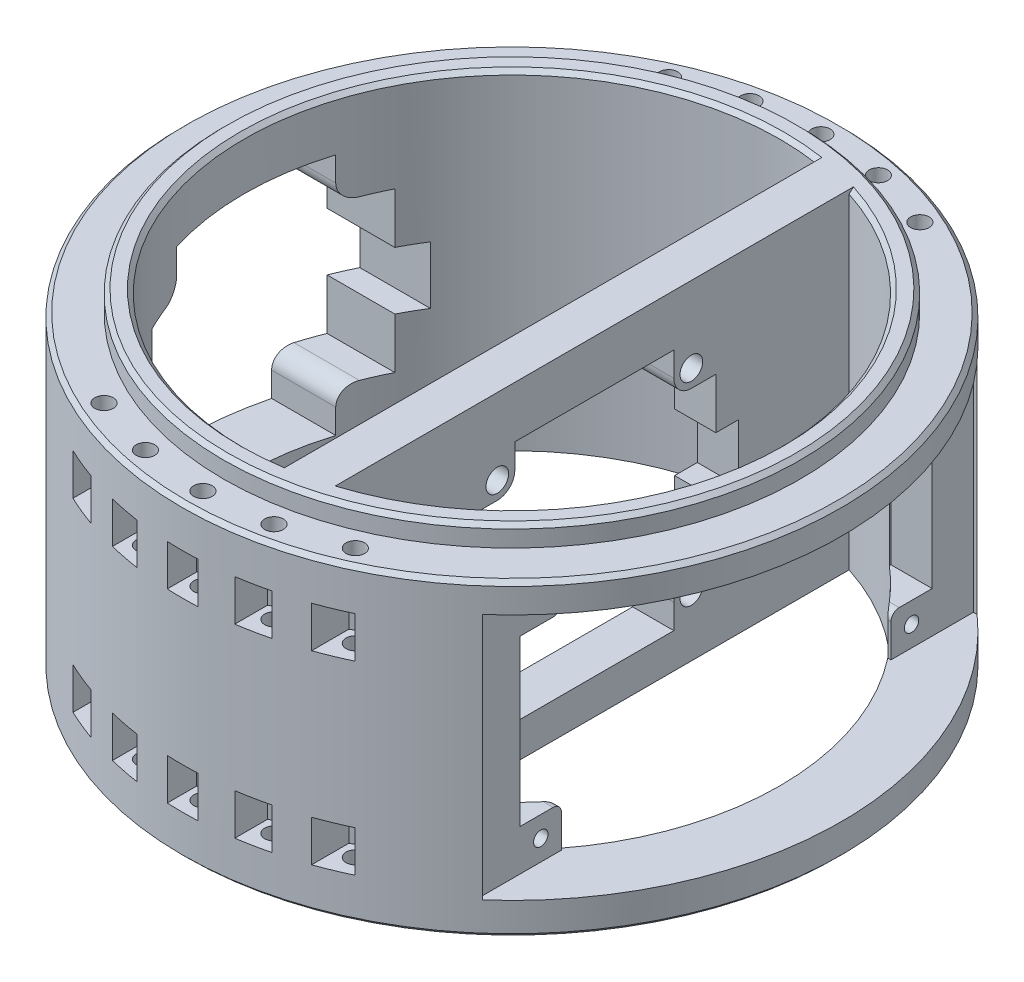
from build123d import *

# Parameters (mm, degrees)
BOSS_EXTRUDE1_OUTLINE_R = 80
BOSS_EXTRUDE1_DEPTH     = 80
CUT_EXTRUDE4_DEPTH      = 139.564064606
CUT_EXTRUDE4_DEPTH_BACK = 139.564064606
SKETCH4_R               = 4
CUT_EXTRUDE1_START      = -80.000000101
CUT_EXTRUDE1_OUTLINE_R  = 4
CUT_EXTRUDE1_DEPTH      = 100.000000101
CUT_EXTRUDE10_START     = 29
SKETCH2_4_R             = 2.75
CUT_EXTRUDE10_DEPTH     = 20
CUT_EXTRUDE11_START     = 52
SKETCH7_W               = 120
SKETCH7_H               = 60
CUT_EXTRUDE11_DEPTH     = 87.564064779
SKETCH8_R               = 1.75
CUT_EXTRUDE12_DEPTH     = 20
CUT_EXTRUDE_5_DEPTH     = 10
SKETCH_1_R              = 111.428602378
SKETCH_1_R_2            = 70
CUT_EXTRUDE_1_DEPTH     = 5
SKETCH_2_R              = 2.25
CUT_EXTRUDE_2_DEPTH     = 139.564064779
CUT_EXTRUDE_START       = 55
SKETCH_2_3_R            = 2.25
CUT_EXTRUDE_3_DEPTH     = 10
CUT_EXTRUDE_START_2     = 10
CUT_EXTRUDE_6_DEPTH     = 10
CHAMFER_1_SIZE          = 1
CHAMFER_2_SIZE          = 1
CUT_EXTRUDE_START_3     = -3
CUT_EXTRUDE_4_DEPTH     = 10
FILLET_1_R              = 2


# Read off the part's stored shape, not the designer's step: Boss-Extrude1, Cut-Extrude1
with BuildPart() as part:
    # Boss-Extrude1 outline → Boss-Extrude1 (new body)
    with BuildSketch(Plane(origin=(0, 0, 0), x_dir=(1, 0, 0), z_dir=(0, 1, 0))):
        Circle(BOSS_EXTRUDE1_OUTLINE_R)
        with BuildLine():
            ThreePointArc((10, -64.226162893), (-65, 0), (10, 64.226162893))
            Line((10, 64.226162893), (10, -64.226162893))
        make_face(mode=Mode.SUBTRACT)
        with BuildLine():
            Line((20, -61.846584384), (20, 61.846584384))
            ThreePointArc((20, 61.846584384), (65, 0), (20, -61.846584384))
        make_face(mode=Mode.SUBTRACT)
    extrude(amount=BOSS_EXTRUDE1_DEPTH)

    # Sketch4 → Cut-Extrude4 (cut, two sides: drawn at the far end of the back side and taken through both)
    with BuildSketch(Plane(origin=(0, 0, 0), x_dir=(0, 0, -1), z_dir=(1, 0, 0)).offset(-CUT_EXTRUDE4_DEPTH_BACK)):
        with Locations((0, 38)):
            Circle(SKETCH4_R)
    extrude(amount=CUT_EXTRUDE4_DEPTH + CUT_EXTRUDE4_DEPTH_BACK, mode=Mode.SUBTRACT)

    # Cut-Extrude1 outline → Cut-Extrude1 (cut)
    with BuildSketch(Plane(origin=(0, 0, 0), x_dir=(0, 0, -1), z_dir=(1, 0, 0)).offset(CUT_EXTRUDE1_START)):
        with BuildLine():
            ThreePointArc((19.3, 14.45), (20.54479618, 17.45520382), (23.55, 18.7))
            Line((23.55, 18.7), (29.5, 18.7))
            Line((29.5, 18.7), (29.5, 31))
            Line((29.5, 31), (35, 31))
            Line((35, 31), (35, 45))
            Line((35, 45), (29.5, 45))
            Line((29.5, 45), (29.5, 57.3))
            Line((29.5, 57.3), (23.55, 57.3))
            ThreePointArc((23.55, 57.3), (20.54479618, 58.54479618), (19.3, 61.55))
            Line((19.3, 61.55), (19.3, 67.5))
            Line((19.3, 67.5), (-19.3, 67.5))
            Line((-19.3, 67.5), (-19.3, 61.55))
            ThreePointArc((-19.3, 61.55), (-20.54479618, 58.54479618), (-23.55, 57.3))
            Line((-23.55, 57.3), (-29.5, 57.3))
            Line((-29.5, 57.3), (-29.5, 45))
            Line((-29.5, 45), (-35, 45))
            Line((-35, 45), (-35, 31))
            Line((-35, 31), (-29.5, 31))
            Line((-29.5, 31), (-29.5, 18.7))
            Line((-29.5, 18.7), (-23.55, 18.7))
            ThreePointArc((-23.55, 18.7), (-20.54479618, 17.45520382), (-19.3, 14.45))
            Line((-19.3, 14.45), (-19.3, 8.5))
            Line((-19.3, 8.5), (19.3, 8.5))
            Line((19.3, 8.5), (19.3, 14.45))
        make_face()
        with Locations((0, 38)):
            Circle(CUT_EXTRUDE1_OUTLINE_R, mode=Mode.SUBTRACT)
    extrude(amount=CUT_EXTRUDE1_DEPTH, mode=Mode.SUBTRACT)

    # Sketch2<4> → Cut-Extrude10 (cut)
    with BuildSketch(Plane(origin=(0, 0, 0), x_dir=(0, 0, -1), z_dir=(1, 0, 0)).offset(CUT_EXTRUDE10_START)):
        with Locations(Location((-23.55, 61.55, 0), (0, 0, 180))):
            Circle(SKETCH2_4_R)
        with Locations(Location((23.55, 61.55, 0), (0, 0, 180))):
            Circle(SKETCH2_4_R)
        with Locations(Location((-23.55, 14.45, 0), (0, 0, 180))):
            Circle(SKETCH2_4_R)
        with Locations(Location((23.55, 14.45, 0), (0, 0, 180))):
            Circle(SKETCH2_4_R)
    extrude(amount=-CUT_EXTRUDE10_DEPTH, mode=Mode.SUBTRACT)

    # Sketch7 → Cut-Extrude11 (cut, through all)
    with BuildSketch(Plane(origin=(0, 0, 0), x_dir=(0, 0, -1), z_dir=(1, 0, 0)).offset(CUT_EXTRUDE11_START)):
        with Locations((0, 38)):
            Rectangle(SKETCH7_W, SKETCH7_H)
    extrude(amount=CUT_EXTRUDE11_DEPTH, mode=Mode.SUBTRACT)

    # Sketch8 → Cut-Extrude12 (cut)
    with BuildSketch(Plane(origin=(52, 0, 0), x_dir=(0, 0, -1), z_dir=(1, 0, 0))):
        with Locations((-45, 63)):
            Circle(SKETCH8_R)
        with Locations((-45, 13)):
            Circle(SKETCH8_R)
        with Locations((45, 13)):
            Circle(SKETCH8_R)
        with Locations((45, 63)):
            Circle(SKETCH8_R)
    extrude(amount=-CUT_EXTRUDE12_DEPTH, mode=Mode.SUBTRACT)

    # Sketch8<4> → Вырез-Вытянуть5 (cut)
    with BuildSketch(Plane(origin=(52, 0, 0), x_dir=(0, 0, -1), z_dir=(1, 0, 0))):
        Polygon((-40, 58), (-45, 58), (-50, 58), (-50, 18), (-45, 18), (-40, 18), (-40, 8), (39, 8), (39, 68), (-40, 68), align=None)
        Polygon((40, 68), (39, 68), (39, 8), (40, 8), (40, 18), (45, 18), (50, 18), (50, 58), (45, 58), (40, 58), align=None)
    extrude(amount=-CUT_EXTRUDE_5_DEPTH, mode=Mode.SUBTRACT)

    # Эскиз1 → Вырез-Вытянуть1 (cut)
    with BuildSketch(Plane(origin=(0, 80, 0), x_dir=(1, 0, 0), z_dir=(0, 1, 0))):
        Circle(SKETCH_1_R)
        with Locations(Location((0, 0, 0), (0, 0, 270))):
            Circle(SKETCH_1_R_2, mode=Mode.SUBTRACT)
    extrude(amount=-CUT_EXTRUDE_1_DEPTH, mode=Mode.SUBTRACT)

    # Эскиз2 → Вырез-Вытянуть2 (cut, through all)
    with BuildSketch(Plane(origin=(0, 0, 0), x_dir=(1, 0, 0), z_dir=(0, 1, 0))):
        with Locations(Location((0, 75, 0), (0, 0, 270))):
            Circle(SKETCH_2_R)
        with Locations(Location((15.593376811, 73.361070055, 0), (0, 0, 270))):
            Circle(SKETCH_2_R)
        with Locations(Location((30.505248231, 68.515909323, 0), (0, 0, 270))):
            Circle(SKETCH_2_R)
        with Locations(Location((-30.505248231, 68.515909323, 0), (0, 0, 90))):
            Circle(SKETCH_2_R)
        with Locations(Location((-15.593376811, 73.361070055, 0), (0, 0, 90))):
            Circle(SKETCH_2_R)
    cut_extrude_2 = extrude(amount=CUT_EXTRUDE_2_DEPTH, mode=Mode.SUBTRACT)

    # Эскиз2<3> → Вырез-Вытянуть3 (cut)
    # profile 1 of 5: a face of its own
    with BuildSketch(Plane(origin=(0, 0, 0), x_dir=(1, 0, 0), z_dir=(0, 1, 0)).offset(CUT_EXTRUDE_START)):
        with BuildLine():
            ThreePointArc((3.75, 79.912061042), (0, 80), (-3.75, 79.912061042))
            Line((-3.75, 79.912061042), (-3.75, 72.834936491))
            Line((-3.75, 72.834936491), (0, 70.669872981))
            Line((0, 70.669872981), (3.75, 72.834936491))
            Line((3.75, 72.834936491), (3.75, 79.912061042))
        make_face()
        with Locations(Location((0, 75, 0), (0, 0, 270))):
            Circle(SKETCH_2_3_R, mode=Mode.SUBTRACT)
    # profile 2 of 5: a face of its own
    with BuildSketch(Plane(origin=(0, 0, 0), x_dir=(1, 0, 0), z_dir=(0, 1, 0)).offset(CUT_EXTRUDE_START)):
        with BuildLine():
            ThreePointArc((-11.843376811, 79.118483464), (-15.61121696, 78.462028428), (-19.343376811, 77.626244103))
            Line((-19.343376811, 77.626244103), (-19.343376811, 71.196006546))
            Line((-19.343376811, 71.196006546), (-15.593376811, 69.030943036))
            Line((-15.593376811, 69.030943036), (-11.843376811, 71.196006546))
            Line((-11.843376811, 71.196006546), (-11.843376811, 79.118483464))
        make_face()
        with Locations(Location((-15.593376811, 73.361070055, 0), (0, 0, 90))):
            Circle(SKETCH_2_3_R, mode=Mode.SUBTRACT)
    # profile 3 of 5: a face of its own
    with BuildSketch(Plane(origin=(0, 0, 0), x_dir=(1, 0, 0), z_dir=(0, 1, 0)).offset(CUT_EXTRUDE_START)):
        with BuildLine():
            ThreePointArc((19.343376811, 77.626244103), (15.61121696, 78.462028428), (11.843376811, 79.118483464))
            Line((11.843376811, 79.118483464), (11.843376811, 71.196006546))
            Line((11.843376811, 71.196006546), (15.593376811, 69.030943036))
            Line((15.593376811, 69.030943036), (19.343376811, 71.196006546))
            Line((19.343376811, 71.196006546), (19.343376811, 77.626244103))
        make_face()
        with Locations(Location((15.593376811, 73.361070055, 0), (0, 0, 270))):
            Circle(SKETCH_2_3_R, mode=Mode.SUBTRACT)
    # profile 4 of 5: a face of its own
    with BuildSketch(Plane(origin=(0, 0, 0), x_dir=(1, 0, 0), z_dir=(0, 1, 0)).offset(CUT_EXTRUDE_START)):
        with BuildLine():
            ThreePointArc((-26.755248231, 75.393346471), (-30.544557454, 73.939367119), (-34.255248231, 72.295075687))
            Line((-34.255248231, 72.295075687), (-34.255248231, 66.350845814))
            Line((-34.255248231, 66.350845814), (-30.505248231, 64.185782304))
            Line((-30.505248231, 64.185782304), (-26.755248231, 66.350845814))
            Line((-26.755248231, 66.350845814), (-26.755248231, 75.393346471))
        make_face()
        with Locations(Location((-30.505248231, 68.515909323, 0), (0, 0, 90))):
            Circle(SKETCH_2_3_R, mode=Mode.SUBTRACT)
    # profile 5 of 5: a face of its own
    with BuildSketch(Plane(origin=(0, 0, 0), x_dir=(1, 0, 0), z_dir=(0, 1, 0)).offset(CUT_EXTRUDE_START)):
        with BuildLine():
            ThreePointArc((34.255248231, 72.295075687), (30.544557454, 73.939367119), (26.755248231, 75.393346471))
            Line((26.755248231, 75.393346471), (26.755248231, 66.350845814))
            Line((26.755248231, 66.350845814), (30.505248231, 64.185782304))
            Line((30.505248231, 64.185782304), (34.255248231, 66.350845814))
            Line((34.255248231, 66.350845814), (34.255248231, 72.295075687))
        make_face()
        with Locations(Location((30.505248231, 68.515909323, 0), (0, 0, 270))):
            Circle(SKETCH_2_3_R, mode=Mode.SUBTRACT)
    cut_extrude_3 = extrude(amount=CUT_EXTRUDE_3_DEPTH, mode=Mode.SUBTRACT)

    # Эскиз2<4> → Вырез-Вытянуть6 (cut)
    with BuildSketch(Plane(origin=(0, 0, 0), x_dir=(1, 0, 0), z_dir=(0, 1, 0)).offset(CUT_EXTRUDE_START_2)):
        with BuildLine():
            Line((0, 79.330127019), (-3.75, 77.165063509))
            Line((-3.75, 77.165063509), (-0.612372436, 77.165063509))
            ThreePointArc((-0.612372436, 77.165063509), (0, 77.25), (0.612372436, 77.165063509))
            Line((0.612372436, 77.165063509), (3.75, 77.165063509))
            Line((3.75, 77.165063509), (0, 79.330127019))
        make_face()
        Polygon((-3.75, 92.498176102), (-3.75, 77.165063509), (0, 79.330127019), (3.75, 77.165063509), (3.75, 92.498176102), align=None)
        with BuildLine():
            Line((-0.612372436, 77.165063509), (-3.75, 77.165063509))
            Line((-3.75, 77.165063509), (-3.75, 72.834936491))
            Line((-3.75, 72.834936491), (0, 70.669872981))
            Line((0, 70.669872981), (3.75, 72.834936491))
            Line((3.75, 72.834936491), (3.75, 77.165063509))
            Line((3.75, 77.165063509), (0.612372436, 77.165063509))
            ThreePointArc((0.612372436, 77.165063509), (1.794482931, 76.357324946), (2.25, 75))
            ThreePointArc((2.25, 75), (-1.357324946, 73.205517069), (-0.612372436, 77.165063509))
        make_face()
        with BuildLine():
            ThreePointArc((0.612372436, 77.165063509), (0, 77.25), (-0.612372436, 77.165063509))
            Line((-0.612372436, 77.165063509), (0.612372436, 77.165063509))
        make_face()
        with BuildLine():
            Line((0.612372436, 77.165063509), (-0.612372436, 77.165063509))
            ThreePointArc((-0.612372436, 77.165063509), (-1.357324946, 73.205517069), (2.25, 75))
            ThreePointArc((2.25, 75), (1.794482931, 76.357324946), (0.612372436, 77.165063509))
        make_face()
        Polygon((11.843376811, 90.859246157), (11.843376811, 75.526133564), (15.593376811, 77.691197074), (19.343376811, 75.526133564), (19.343376811, 90.859246157), align=None)
        with BuildLine():
            Line((14.981004376, 75.526133564), (11.843376811, 75.526133564))
            Line((11.843376811, 75.526133564), (11.843376811, 71.196006546))
            Line((11.843376811, 71.196006546), (15.593376811, 69.030943036))
            Line((15.593376811, 69.030943036), (19.343376811, 71.196006546))
            Line((19.343376811, 71.196006546), (19.343376811, 75.526133564))
            Line((19.343376811, 75.526133564), (16.205749247, 75.526133564))
            ThreePointArc((16.205749247, 75.526133564), (17.387859742, 74.718395001), (17.843376811, 73.361070055))
            ThreePointArc((17.843376811, 73.361070055), (14.236051865, 71.566587124), (14.981004376, 75.526133564))
        make_face()
        with BuildLine():
            Line((15.593376811, 77.691197074), (11.843376811, 75.526133564))
            Line((11.843376811, 75.526133564), (14.981004376, 75.526133564))
            ThreePointArc((14.981004376, 75.526133564), (15.593376811, 75.611070055), (16.205749247, 75.526133564))
            Line((16.205749247, 75.526133564), (19.343376811, 75.526133564))
            Line((19.343376811, 75.526133564), (15.593376811, 77.691197074))
        make_face()
        with BuildLine():
            ThreePointArc((16.205749247, 75.526133564), (15.593376811, 75.611070055), (14.981004376, 75.526133564))
            Line((14.981004376, 75.526133564), (16.205749247, 75.526133564))
        make_face()
        with BuildLine():
            Line((16.205749247, 75.526133564), (14.981004376, 75.526133564))
            ThreePointArc((14.981004376, 75.526133564), (14.236051865, 71.566587124), (17.843376811, 73.361070055))
            ThreePointArc((17.843376811, 73.361070055), (17.387859742, 74.718395001), (16.205749247, 75.526133564))
        make_face()
        Polygon((26.755248231, 86.014085426), (26.755248231, 70.680972833), (30.505248231, 72.846036342), (34.255248231, 70.680972833), (34.255248231, 86.014085426), align=None)
        with BuildLine():
            Line((29.892875795, 70.680972833), (26.755248231, 70.680972833))
            Line((26.755248231, 70.680972833), (26.755248231, 66.350845814))
            Line((26.755248231, 66.350845814), (30.505248231, 64.185782304))
            Line((30.505248231, 64.185782304), (34.255248231, 66.350845814))
            Line((34.255248231, 66.350845814), (34.255248231, 70.680972833))
            Line((34.255248231, 70.680972833), (31.117620666, 70.680972833))
            ThreePointArc((31.117620666, 70.680972833), (32.299731162, 69.873234269), (32.755248231, 68.515909323))
            ThreePointArc((32.755248231, 68.515909323), (29.147923284, 66.721426392), (29.892875795, 70.680972833))
        make_face()
        with BuildLine():
            Line((30.505248231, 72.846036342), (26.755248231, 70.680972833))
            Line((26.755248231, 70.680972833), (29.892875795, 70.680972833))
            ThreePointArc((29.892875795, 70.680972833), (30.505248231, 70.765909323), (31.117620666, 70.680972833))
            Line((31.117620666, 70.680972833), (34.255248231, 70.680972833))
            Line((34.255248231, 70.680972833), (30.505248231, 72.846036342))
        make_face()
        with BuildLine():
            ThreePointArc((31.117620666, 70.680972833), (30.505248231, 70.765909323), (29.892875795, 70.680972833))
            Line((29.892875795, 70.680972833), (31.117620666, 70.680972833))
        make_face()
        with BuildLine():
            Line((31.117620666, 70.680972833), (29.892875795, 70.680972833))
            ThreePointArc((29.892875795, 70.680972833), (29.147923284, 66.721426392), (32.755248231, 68.515909323))
            ThreePointArc((32.755248231, 68.515909323), (32.299731162, 69.873234269), (31.117620666, 70.680972833))
        make_face()
        Polygon((-19.343376811, 90.859246157), (-19.343376811, 75.526133564), (-15.593376811, 77.691197074), (-11.843376811, 75.526133564), (-11.843376811, 90.859246157), align=None)
        with BuildLine():
            Line((-16.205749247, 75.526133564), (-19.343376811, 75.526133564))
            Line((-19.343376811, 75.526133564), (-19.343376811, 71.196006546))
            Line((-19.343376811, 71.196006546), (-15.593376811, 69.030943036))
            Line((-15.593376811, 69.030943036), (-11.843376811, 71.196006546))
            Line((-11.843376811, 71.196006546), (-11.843376811, 75.526133564))
            Line((-11.843376811, 75.526133564), (-14.981004376, 75.526133564))
            ThreePointArc((-14.981004376, 75.526133564), (-13.79889388, 74.718395001), (-13.343376811, 73.361070055))
            ThreePointArc((-13.343376811, 73.361070055), (-16.950701758, 71.566587124), (-16.205749247, 75.526133564))
        make_face()
        with BuildLine():
            Line((-15.593376811, 77.691197074), (-19.343376811, 75.526133564))
            Line((-19.343376811, 75.526133564), (-16.205749247, 75.526133564))
            ThreePointArc((-16.205749247, 75.526133564), (-15.593376811, 75.611070055), (-14.981004376, 75.526133564))
            Line((-14.981004376, 75.526133564), (-11.843376811, 75.526133564))
            Line((-11.843376811, 75.526133564), (-15.593376811, 77.691197074))
        make_face()
        with BuildLine():
            ThreePointArc((-14.981004376, 75.526133564), (-15.593376811, 75.611070055), (-16.205749247, 75.526133564))
            Line((-16.205749247, 75.526133564), (-14.981004376, 75.526133564))
        make_face()
        with BuildLine():
            Line((-14.981004376, 75.526133564), (-16.205749247, 75.526133564))
            ThreePointArc((-16.205749247, 75.526133564), (-16.950701758, 71.566587124), (-13.343376811, 73.361070055))
            ThreePointArc((-13.343376811, 73.361070055), (-13.79889388, 74.718395001), (-14.981004376, 75.526133564))
        make_face()
        Polygon((-34.255248231, 86.014085426), (-34.255248231, 70.680972833), (-30.505248231, 72.846036342), (-26.755248231, 70.680972833), (-26.755248231, 86.014085426), align=None)
        with BuildLine():
            Line((-31.117620666, 70.680972833), (-34.255248231, 70.680972833))
            Line((-34.255248231, 70.680972833), (-34.255248231, 66.350845814))
            Line((-34.255248231, 66.350845814), (-30.505248231, 64.185782304))
            Line((-30.505248231, 64.185782304), (-26.755248231, 66.350845814))
            Line((-26.755248231, 66.350845814), (-26.755248231, 70.680972833))
            Line((-26.755248231, 70.680972833), (-29.892875795, 70.680972833))
            ThreePointArc((-29.892875795, 70.680972833), (-28.7107653, 69.873234269), (-28.255248231, 68.515909323))
            ThreePointArc((-28.255248231, 68.515909323), (-31.862573177, 66.721426392), (-31.117620666, 70.680972833))
        make_face()
        with BuildLine():
            Line((-30.505248231, 72.846036342), (-34.255248231, 70.680972833))
            Line((-34.255248231, 70.680972833), (-31.117620666, 70.680972833))
            ThreePointArc((-31.117620666, 70.680972833), (-30.505248231, 70.765909323), (-29.892875795, 70.680972833))
            Line((-29.892875795, 70.680972833), (-26.755248231, 70.680972833))
            Line((-26.755248231, 70.680972833), (-30.505248231, 72.846036342))
        make_face()
        with BuildLine():
            ThreePointArc((-29.892875795, 70.680972833), (-30.505248231, 70.765909323), (-31.117620666, 70.680972833))
            Line((-31.117620666, 70.680972833), (-29.892875795, 70.680972833))
        make_face()
        with BuildLine():
            Line((-29.892875795, 70.680972833), (-31.117620666, 70.680972833))
            ThreePointArc((-31.117620666, 70.680972833), (-31.862573177, 66.721426392), (-28.255248231, 68.515909323))
            ThreePointArc((-28.255248231, 68.515909323), (-28.7107653, 69.873234269), (-29.892875795, 70.680972833))
        make_face()
    cut_extrude_6 = extrude(amount=CUT_EXTRUDE_6_DEPTH, mode=Mode.SUBTRACT)

    # Зеркальное отражение1: Вырез-Вытянуть2, Вырез-Вытянуть3, Вырез-Вытянуть6 across plane
    add(cut_extrude_2.mirror(Plane.XY), mode=Mode.SUBTRACT)
    add(cut_extrude_3.mirror(Plane.XY), mode=Mode.SUBTRACT)
    add(cut_extrude_6.mirror(Plane.XY), mode=Mode.SUBTRACT)

    # Фаска1
    chamfer_1_edges = [part.edges().sort_by_distance(p)[0] for p in [
        (-65, 80, 0),
        (-80, 75, 0),
        (0, 80, -70),
        (65, 80, 0),
    ]]
    chamfer(chamfer_1_edges, length=CHAMFER_1_SIZE)

    # Фаска2
    chamfer_2_edges = [part.edges().sort_by_distance(p)[0] for p in [
        (-80, 0, 0),
    ]]
    chamfer(chamfer_2_edges, length=CHAMFER_2_SIZE)

    # Эскиз4 → Вырез-Вытянуть4 (cut)
    with BuildSketch(Plane(origin=(52, 0, 0), x_dir=(0, 0, -1), z_dir=(1, 0, 0)).offset(CUT_EXTRUDE_START_3)):
        Polygon((-48, 14.732050808), (-48, 11.267949192), (-45, 9.535898385), (-42, 11.267949192), (-42, 14.732050808), (-45, 16.464101615), align=None)
        Polygon((-45, 66.464101615), (-48, 64.732050808), (-48, 61.267949192), (-45, 59.535898385), (-42, 61.267949192), (-42, 64.732050808), align=None)
        Polygon((42, 14.732050808), (42, 11.267949192), (45, 9.535898385), (48, 11.267949192), (48, 14.732050808), (45, 16.464101615), align=None)
        Polygon((42, 64.732050808), (42, 61.267949192), (45, 59.535898385), (48, 61.267949192), (48, 64.732050808), (45, 66.464101615), align=None)
    extrude(amount=-CUT_EXTRUDE_4_DEPTH, mode=Mode.SUBTRACT)

    # Скругление1
    fillet_1_edges = [part.edges().sort_by_distance(p)[0] for p in [
        (51.617376915, 58, -40),
        (51.617376915, 18, -40),
        (51.617376915, 18, 40),
        (51.617376915, 58, 40),
    ]]
    fillet(fillet_1_edges, radius=FILLET_1_R)


solid = part.part
